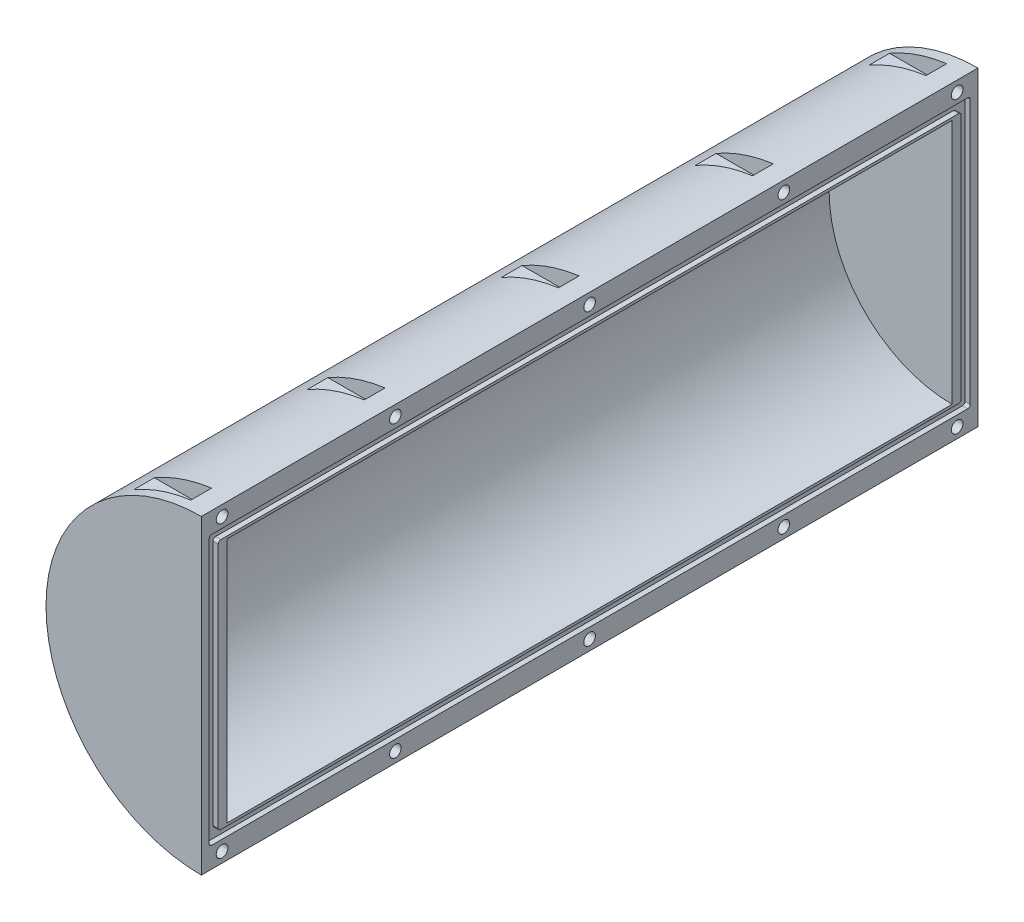
from build123d import *

# Parameters (mm, degrees)
BOSS_EXTRUDE1_DEPTH            = 280
BOSS_EXTRUDE3_START            = 10
BOSS_EXTRUDE3_DEPTH            = 10
CUT_EXTRUDE_THIN1_START        = -2
CUT_EXTRUDE_THIN1_DEPTH        = 2
FILLET6_R                      = 1
SKETCH11_W                     = 8
SKETCH11_H                     = 8
SKETCH11_W_2                   = 8.009527264
CUT_EXTRUDE1_DEPTH             = 51
M4_CLEARANCE_HOLE1_D           = 4.5
M4_CLEARANCE_HOLE1_CSINK_D     = 4.55
M4_CLEARANCE_HOLE1_CSINK_ANGLE = 90


# Read off the part's stored shape, not the designer's step: Cut-Extrude-Thin1
with BuildPart() as part:
    # Sketch1 → Boss-Extrude1 (new body)
    with BuildSketch(Plane.XY):
        with BuildLine():
            Line((0, 52), (-2, 52))
            Line((-2, 52), (-2, 48.5))
            Line((-2, 48.5), (0, 48.5))
            Line((0, 48.5), (0, 47.5))
            ThreePointArc((0, 47.5), (-47.5, 0), (0, -47.5))
            Line((0, -47.5), (0, -48.5))
            Line((0, -48.5), (-2, -48.5))
            Line((-2, -48.5), (-2, -52))
            Line((-2, -52), (0, -52))
            Line((0, -52), (0, -60))
            ThreePointArc((0, -60), (-60, 0), (0, 60))
            Line((0, 60), (0, 52))
        make_face()
    extrude(amount=-BOSS_EXTRUDE1_DEPTH)

    # Sketch7 → Boss-Extrude3 (add)
    with BuildSketch(Plane.XY.offset(BOSS_EXTRUDE3_START)):
        with BuildLine():
            Line((0, 60), (0, -60))
            ThreePointArc((0, -60), (-60, 0), (0, 60))
        make_face()
    boss_extrude3 = extrude(amount=-BOSS_EXTRUDE3_DEPTH)

    # Mirror1: Boss-Extrude3 across plane
    add(boss_extrude3.mirror(Plane.XY.offset(-140)))

    # Cut-Extrude-Thin1 outline → Cut-Extrude-Thin1 (cut)
    with BuildSketch(Plane(origin=(0, 0, 0), x_dir=(0, 0, -1), z_dir=(1, 0, 0)).offset(CUT_EXTRUDE_THIN1_START)):
        Polygon((0, 52), (-7, 52), (-7, -52), (0, -52), (0, -48.5), (-3.5, -48.5), (-3.5, 48.5), (0, 48.5), align=None)
    cut_extrude_thin1 = extrude(amount=CUT_EXTRUDE_THIN1_DEPTH, mode=Mode.SUBTRACT)

    # Mirror2: Cut-Extrude-Thin1 across plane
    add(cut_extrude_thin1.mirror(Plane.XY.offset(-140)), mode=Mode.SUBTRACT)

    # Fillet6
    fillet6_edges = [part.edges().sort_by_distance(p)[0] for p in [
        (-1, -52, 7),
        (-1, 52, 7),
        (-1, 48.5, 3.5),
        (-1, -48.5, 3.5),
        (-1, -52, -287),
        (-1, -48.5, -283.5),
        (-1, 48.5, -283.5),
        (-1, 52, -287),
    ]]
    fillet(fillet6_edges, radius=FILLET6_R)

    # Sketch11 → Cut-Extrude1 (cut)
    with BuildSketch(Plane(origin=(-59.040249017, 0, 0), x_dir=(0, 0, -1), z_dir=(-1, 0, 0))):
        with Locations((139.975606131, 56)):
            Rectangle(SKETCH11_W, SKETCH11_H)
        with Locations((-2, 56)):
            Rectangle(SKETCH11_W, SKETCH11_H)
        with Locations((-2, -55.889665958)):
            Rectangle(SKETCH11_W, SKETCH11_H)
        with Locations((139.975606131, -55.889665958)):
            Rectangle(SKETCH11_W, SKETCH11_H)
        with Locations((281.951212263, 56)):
            Rectangle(SKETCH11_W, SKETCH11_H)
        with Locations((281.951212263, -55.889665958)):
            Rectangle(SKETCH11_W, SKETCH11_H)
        with Locations((64.992566698, 56)):
            Rectangle(SKETCH11_W_2, SKETCH11_H)
        with Locations((214.958645565, 56)):
            Rectangle(SKETCH11_W_2, SKETCH11_H)
        with Locations((214.958645565, -55.889665958)):
            Rectangle(SKETCH11_W_2, SKETCH11_H)
        with Locations((64.992566698, -55.889665958)):
            Rectangle(SKETCH11_W_2, SKETCH11_H)
    extrude(amount=-CUT_EXTRUDE1_DEPTH, mode=Mode.SUBTRACT)

    # M4 Clearance Hole1 (through all)
    with Locations(Plane.ZY.offset(8.040249017)):
        with Locations((-281.951212263, 55.889665958), (-281.951212263, -56), (-139.973202333, -56), (2, -56), (2, 55.912652005), (-139.975606131, 55.912652005), (-214.982691693, 55.889665958), (-64.963712973, 55.889665958), (-214.982691693, -56), (-64.963712973, -56)):
            CounterSinkHole(M4_CLEARANCE_HOLE1_D / 2, M4_CLEARANCE_HOLE1_CSINK_D / 2, counter_sink_angle=M4_CLEARANCE_HOLE1_CSINK_ANGLE)


solid = part.part
